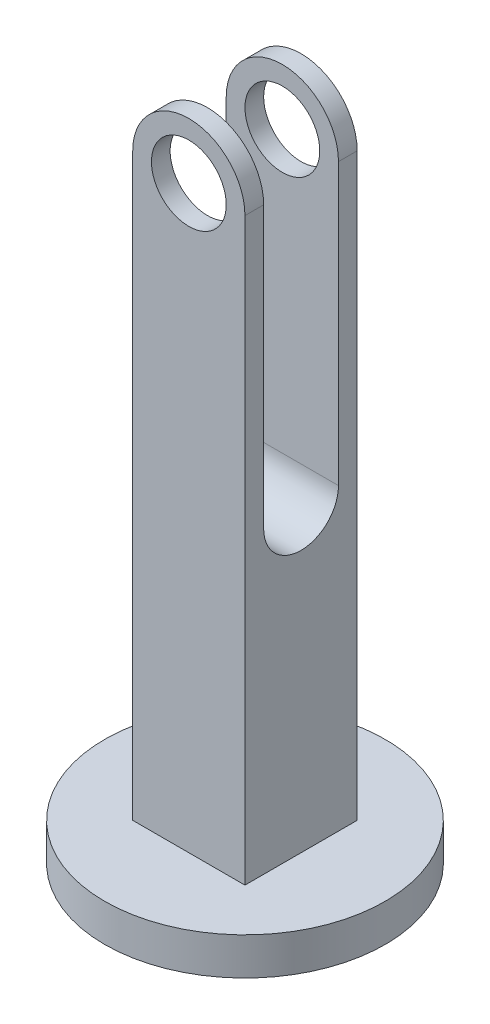
from build123d import *

# Parameters (mm, degrees)
SKETCH1_R           = 75
SKETCH1_W           = 60
SKETCH1_H           = 60
BOSS_EXTRUDE1_DEPTH = 20
SKETCH1_2_W         = 60
SKETCH1_2_H         = 60
BOSS_EXTRUDE2_DEPTH = 360
CUT_EXTRUDE1_DEPTH  = 383.426463519
SKETCH3_R           = 20
CUT_EXTRUDE2_DEPTH  = 383.426463519


with BuildPart() as part:
    # Sketch1 → Boss-Extrude1 (new body)
    with BuildSketch(Plane(origin=(0, 0, 0), x_dir=(1, 0, 0), z_dir=(0, 1, 0))):
        Circle(SKETCH1_R)
        Rectangle(SKETCH1_W, SKETCH1_H, mode=Mode.SUBTRACT)
    extrude(amount=BOSS_EXTRUDE1_DEPTH)

    # Sketch1<2> → Boss-Extrude2 (add)
    with BuildSketch(Plane(origin=(0, 0, 0), x_dir=(1, 0, 0), z_dir=(0, 1, 0))):
        Rectangle(SKETCH1_2_W, SKETCH1_2_H)
    extrude(amount=BOSS_EXTRUDE2_DEPTH)

    # Sketch2 → Cut-Extrude1 (cut, through all)
    with BuildSketch(Plane(origin=(30, 0, 0), x_dir=(0, 0, -1), z_dir=(1, 0, 0))):
        with BuildLine():
            Line((-20, 360), (20, 360))
            Line((20, 360), (20, 180))
            ThreePointArc((20, 180), (0, 160), (-20, 180))
            Line((-20, 180), (-20, 360))
        make_face()
    extrude(amount=-CUT_EXTRUDE1_DEPTH, mode=Mode.SUBTRACT)

    # Sketch3 → Cut-Extrude2 (cut, through all)
    with BuildSketch(Plane.XY.offset(30)):
        with BuildLine():
            Line((-30, 360), (-30, 330))
            ThreePointArc((-30, 330), (-21.21320334, 351.213203531), (2.71e-07, 360))
            Line((2.71e-07, 360), (-30, 360))
        make_face()
        with BuildLine():
            ThreePointArc((2.71e-07, 360), (21.213203531, 351.21320334), (30, 330))
            Line((30, 330), (30, 360))
            Line((30, 360), (2.71e-07, 360))
        make_face()
        with Locations((0, 330)):
            Circle(SKETCH3_R)
    extrude(amount=-CUT_EXTRUDE2_DEPTH, mode=Mode.SUBTRACT)


solid = part.part
